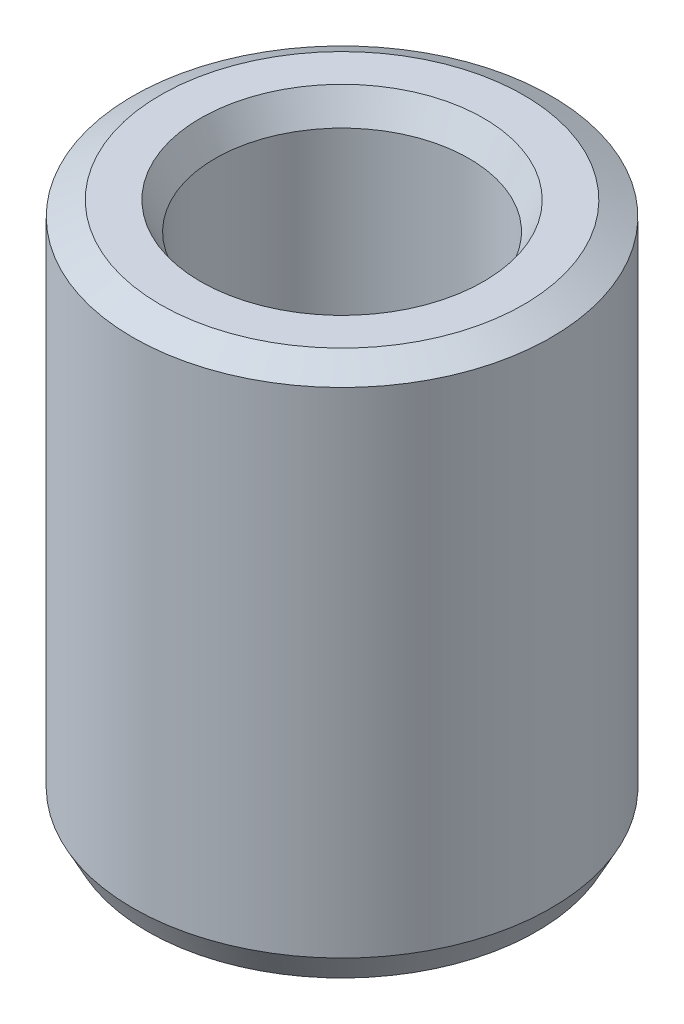
from build123d import *
from OCP.BRepFilletAPI import BRepFilletAPI_MakeChamfer

# Parameters (mm, degrees)
SKETCH1_R           = 50
BOSS_EXTRUDE1_DEPTH = 128.201635518
SKETCH2_R           = 30.339866041
CUT_EXTRUDE1_DEPTH  = 147.409218799
CHAMFER1_SIZE       = 3.493816011
CHAMFER1_SIZE2      = 6.592774982


with BuildPart() as part:
    # Sketch1 → Boss-Extrude1 (new body)
    with BuildSketch(Plane(origin=(0, 0, 0), x_dir=(1, 0, 0), z_dir=(0, 1, 0))):
        Circle(SKETCH1_R)
    extrude(amount=BOSS_EXTRUDE1_DEPTH)

    # Sketch2 → Cut-Extrude1 (cut, through all)
    with BuildSketch(Plane(origin=(0, 0, 0), x_dir=(1, 0, 0), z_dir=(0, 1, 0))):
        Circle(SKETCH2_R)
    extrude(amount=CUT_EXTRUDE1_DEPTH, mode=Mode.SUBTRACT)

    # Chamfer1: one chamfer whose edges measure the first distance from different faces: ONE call of the kernel's chamfer builder (chamfer() names one face for all edges)
    chamfer1_edges_1 = [part.edges().sort_by_distance(p)[0] for p in [
        (-30.339866041, 128.201635518, 0),
    ]]
    chamfer1_side_1 = [part.faces().sort_by_distance(p)[0] for p in [
        (-48.585786438, 128.201635518, 0),
    ]]
    chamfer1_edges_2 = [part.edges().sort_by_distance(p)[0] for p in [
        (-30.339866041, 0, 0),
    ]]
    chamfer1_side_2 = [part.faces().sort_by_distance(p)[0] for p in [
        (-30.339866041, 64.100817759, 0),
    ]]
    chamfer1_edges_3 = [part.edges().sort_by_distance(p)[0] for p in [
        (-50, 0, 0),
    ]]
    chamfer1_side_3 = [part.faces().sort_by_distance(p)[0] for p in [
        (-48.585786438, 0, 0),
    ]]
    chamfer1_edges_4 = [part.edges().sort_by_distance(p)[0] for p in [
        (-50, 128.201635518, 0),
    ]]
    chamfer1_side_4 = [part.faces().sort_by_distance(p)[0] for p in [
        (-50, 64.100817759, 0),
    ]]
    chamfer1 = BRepFilletAPI_MakeChamfer(part.part.solid().wrapped)
    for e in chamfer1_edges_1:
        chamfer1.Add(CHAMFER1_SIZE, CHAMFER1_SIZE2, e.wrapped, chamfer1_side_1[0].wrapped)  # the first distance lies on this face
    for e in chamfer1_edges_2:
        chamfer1.Add(CHAMFER1_SIZE, CHAMFER1_SIZE2, e.wrapped, chamfer1_side_2[0].wrapped)  # the first distance lies on this face
    for e in chamfer1_edges_3:
        chamfer1.Add(CHAMFER1_SIZE, CHAMFER1_SIZE2, e.wrapped, chamfer1_side_3[0].wrapped)  # the first distance lies on this face
    for e in chamfer1_edges_4:
        chamfer1.Add(CHAMFER1_SIZE, CHAMFER1_SIZE2, e.wrapped, chamfer1_side_4[0].wrapped)  # the first distance lies on this face
    add(Compound.cast(chamfer1.Shape()), mode=Mode.REPLACE)


solid = part.part
